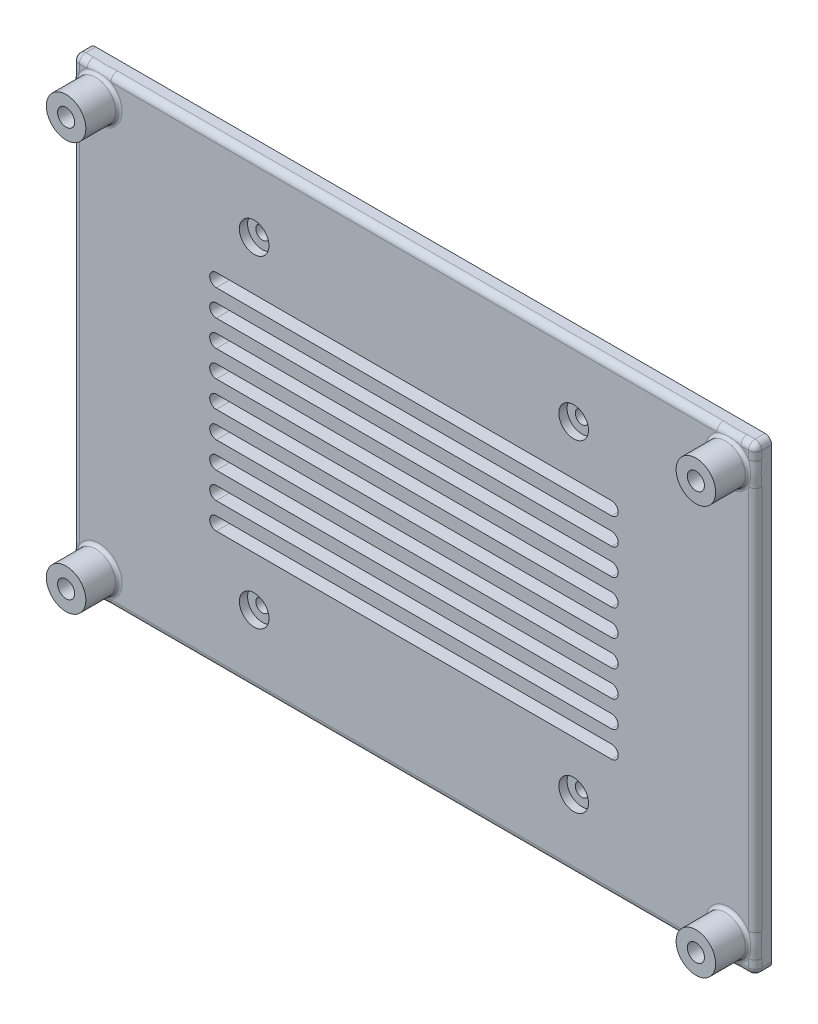
from build123d import *

# Parameters (mm, degrees)
ESQUISSE1_W                                   = 103.6
ESQUISSE1_H                                   = 70
ESQUISSE1_R                                   = 1.005
BOSS_EXTRU_1_DEPTH                            = 2.5
ESQUISSE3_R                                   = 3
BOSS_EXTRU_2_DEPTH                            = 5
CONG_2_R                                      = 0.5
TROU_POUR_TARAUDAGE_POUR_TROU_TARAUD_M3_D     = 2.6
TROU_POUR_TARAUDAGE_POUR_TROU_TARAUD_M3_DEPTH = 5
TROU_POUR_TARAUDAGE_POUR_TROU_TARAUD_M3_TIP   = 0.781118805
ESQUISSE19_R                                  = 2.25
ENL_V_MAT_EXTRU_1_DEPTH                       = 1.25
CONG_3_R                                      = 1
ENL_V_MAT_EXTRU_3_DEPTH                       = 63.71554845
R_P_TITION_LIN_AIRE2_COUNT                    = 5
R_P_TITION_LIN_AIRE2_PITCH                    = 4
R_P_TITION_LIN_AIRE2_COL_COUNT                = 5
R_P_TITION_LIN_AIRE2_COL_PITCH                = 4


with BuildPart() as part:
    # Esquisse1 → Boss.-Extru.1 (new body)
    with BuildSketch(Plane.XY):
        Rectangle(ESQUISSE1_W, ESQUISSE1_H)
        with Locations((-24.25, -24.5)):
            Circle(ESQUISSE1_R, mode=Mode.SUBTRACT)
        with Locations((-24.25, 24.5)):
            Circle(ESQUISSE1_R, mode=Mode.SUBTRACT)
        with Locations((24.25, -24.5)):
            Circle(ESQUISSE1_R, mode=Mode.SUBTRACT)
        with Locations((24.25, 24.5)):
            Circle(ESQUISSE1_R, mode=Mode.SUBTRACT)
    extrude(amount=BOSS_EXTRU_1_DEPTH)

    # Esquisse3 → Boss.-Extru.2 (add)
    with BuildSketch(Plane.XY.offset(2.5)):
        with Locations((-47.8, 31)):
            Circle(ESQUISSE3_R)
        with Locations((47.8, 31)):
            Circle(ESQUISSE3_R)
        with Locations((-47.8, -31)):
            Circle(ESQUISSE3_R)
        with Locations((47.8, -31)):
            Circle(ESQUISSE3_R)
    extrude(amount=BOSS_EXTRU_2_DEPTH)

    # Congé2
    cong_2_edges = [part.edges().sort_by_distance(p)[0] for p in [
        (44.8, 31, 2.5),
        (44.8, -31, 2.5),
        (-50.8, -31, 2.5),
        (-50.8, 31, 2.5),
    ]]
    fillet(cong_2_edges, radius=CONG_2_R)

    # Trou pour taraudage pour trou taraudé M32
    with Locations(Plane.XY.offset(7.5)):
        with Locations((-47.8, -31), (47.8, -31), (47.8, 31), (-47.8, 31)):
            Hole(TROU_POUR_TARAUDAGE_POUR_TROU_TARAUD_M3_D / 2, depth=TROU_POUR_TARAUDAGE_POUR_TROU_TARAUD_M3_DEPTH)
            with Locations((0, 0, -(TROU_POUR_TARAUDAGE_POUR_TROU_TARAUD_M3_DEPTH + TROU_POUR_TARAUDAGE_POUR_TROU_TARAUD_M3_TIP / 2))):  # 118° drill point
                Cone(0, TROU_POUR_TARAUDAGE_POUR_TROU_TARAUD_M3_D / 2, TROU_POUR_TARAUDAGE_POUR_TROU_TARAUD_M3_TIP, mode=Mode.SUBTRACT)

    # Esquisse19 → Enlèv. mat.-Extru.1 (cut)
    with BuildSketch(Plane.XY.offset(2.5)):
        with Locations((24.25, -24.5)):
            Circle(ESQUISSE19_R)
        with Locations((-24.25, -24.5)):
            Circle(ESQUISSE19_R)
        with Locations((-24.25, 24.5)):
            Circle(ESQUISSE19_R)
        with Locations((24.25, 24.5)):
            Circle(ESQUISSE19_R)
    extrude(amount=-ENL_V_MAT_EXTRU_1_DEPTH, mode=Mode.SUBTRACT)

    # Congé3
    cong_3_edges = [part.edges().sort_by_distance(p)[0] for p in [
        (-51.8, 0, 2.5),
        (0, -35, 2.5),
        (0, 35, 2.5),
        (51.8, 0, 2.5),
        (51.8, -35, 1.25),
        (51.8, 35, 1.25),
        (-51.8, 35, 1.25),
        (-51.8, -35, 1.25),
    ]]
    fillet(cong_3_edges, radius=CONG_3_R)

    # Esquisse22 → Enlèv. mat.-Extru.3 (cut, through all)
    with BuildSketch(Plane.XY.offset(2.5)):
        with BuildLine():
            Line((30, -1), (-30, -1))
            ThreePointArc((-30, -1), (-31, 0), (-30, 1))
            Line((-30, 1), (30, 1))
            ThreePointArc((30, 1), (31, 0), (30, -1))
        make_face()
    enl_v_mat_extru_3 = extrude(amount=-ENL_V_MAT_EXTRU_3_DEPTH, mode=Mode.SUBTRACT)

    # Répétition linéaire2: Enlèv. mat.-Extru.3 ×5
    with Locations(*[(0, i * R_P_TITION_LIN_AIRE2_PITCH, 0) for i in range(1, R_P_TITION_LIN_AIRE2_COUNT)]):
        add(enl_v_mat_extru_3, mode=Mode.SUBTRACT)

    # Répétition linéaire2 col: Enlèv. mat.-Extru.3 ×5
    with Locations(*[(0, -i * R_P_TITION_LIN_AIRE2_COL_PITCH, 0) for i in range(1, R_P_TITION_LIN_AIRE2_COL_COUNT)]):
        add(enl_v_mat_extru_3, mode=Mode.SUBTRACT)


solid = part.part
